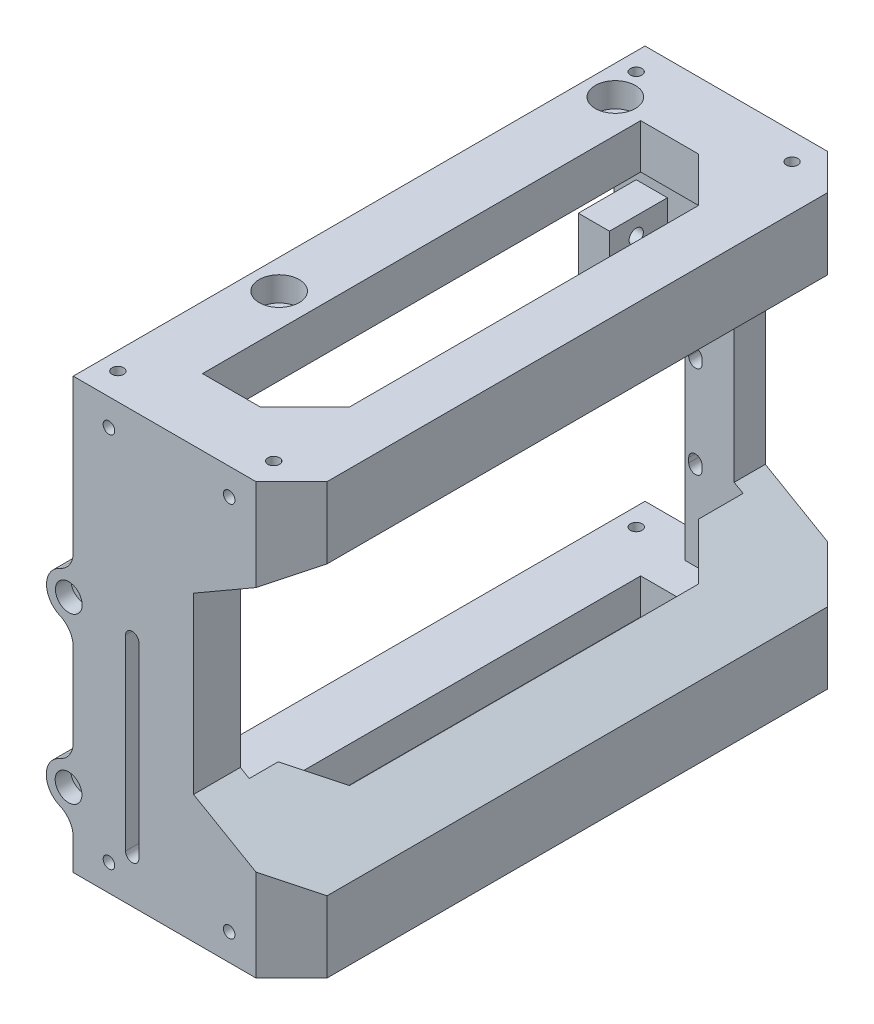
from build123d import *

# Parameters (mm, degrees)
SKETCH1_W            = 33.023864746
SKETCH1_H            = 96.550841869
BOSS_EXTRUDE1_DEPTH  = 10.5
SKETCH2_W            = 128.414742868
SKETCH2_H            = 96.550841869
BOSS_EXTRUDE2_DEPTH  = 10
SKETCH3_W            = 29.023864746
SKETCH3_H            = 117.914742868
BOSS_EXTRUDE3_DEPTH  = 10
SKETCH4_W            = 16
SKETCH4_H            = 7
BOSS_EXTRUDE4_DEPTH  = 96.550842
CUT_EXTRUDE1_DEPTH   = 10
SKETCH6_W            = 43.023864746
SKETCH6_H            = 8
BOSS_EXTRUDE5_DEPTH  = 115
SKETCH7_W            = 106
SKETCH7_H            = 44
CUT_EXTRUDE2_DEPTH   = 115
SKETCH8_W            = 10
SKETCH8_H            = 96.550841869
BOSS_EXTRUDE6_DEPTH  = 128.414743
CUT_EXTRUDE3_DEPTH   = 210
CHAMFER1_SIZE        = 8
CUT_EXTRUDE4_DEPTH   = 210
SKETCH11_W           = 149.172652418
SKETCH11_H           = 103.352018373
CUT_EXTRUDE5_DEPTH   = 16
BOSS_EXTRUDE7_START  = -10.5
SKETCH12_R           = 5
SKETCH12_R_2         = 1.49999954
BOSS_EXTRUDE7_DEPTH  = 10.5
FILLET1_R            = 5
BOSS_EXTRUDE8_REACH  = 652.428
CUT_EXTRUDE6_DEPTH   = 3.5
SKETCH15_R           = 4.5
CUT_EXTRUDE7_DEPTH   = 5.5
SKETCH16_R           = 3
SKETCH16_R_2         = 2.65
BOSS_EXTRUDE9_DEPTH  = 4.5
SKETCH17_R           = 3
CUT_EXTRUDE8_DEPTH   = 3.5
BOSS_EXTRUDE10_START = -7
SKETCH18_W           = 13.023864746
SKETCH18_H           = 35
BOSS_EXTRUDE10_DEPTH = 7
SKETCH19_W           = 12
SKETCH19_H           = 2
CUT_EXTRUDE9_DEPTH   = 3
SKETCH20_W           = 13
SKETCH20_H           = 25
BOSS_EXTRUDE11_DEPTH = 7
SKETCH22_R           = 1.6
CUT_EXTRUDE10_DEPTH  = 10
CUT_EXTRUDE11_DEPTH  = 3.5
SKETCH26_R           = 1.3
CUT_EXTRUDE13_DEPTH  = 12
SKETCH27_R           = 1.3
CUT_EXTRUDE14_DEPTH  = 12
CUT_EXTRUDE15_START  = -12
SKETCH28_R           = 1.3
CUT_EXTRUDE15_DEPTH  = 12
CUT_EXTRUDE16_START  = -12
SKETCH29_R           = 1.3
CUT_EXTRUDE16_DEPTH  = 12
CUT_EXTRUDE17_DEPTH  = 5
CHAMFER2_SIZE        = 3


with BuildPart() as part:
    # Sketch1 → Boss-Extrude1 (new body)
    with BuildSketch(Plane.XY):
        with Locations((-614.925933838, 559.805450232)):
            Rectangle(SKETCH1_W, SKETCH1_H)
        with BuildLine():
            Line((-612.69214266, 563.58759012), (-612.69214266, 521.58759284))
            ThreePointArc((-612.69214266, 521.58759284), (-614.1921422, 520.0875933), (-615.69214174, 521.58759284))
            Line((-615.69214174, 521.58759284), (-615.69214174, 563.58759012))
            ThreePointArc((-615.69214174, 563.58759012), (-614.1921422, 565.08758966), (-612.69214266, 563.58759012))
        make_face(mode=Mode.SUBTRACT)
        with BuildLine():
            ThreePointArc((-627.420522995, 528.643794724), (-629.559518923, 528.646587243), (-629.526513109, 526.507844154))
            ThreePointArc((-629.526513109, 526.507844154), (-627.423249907, 526.540283149), (-627.420522995, 528.643794724))
        make_face(mode=Mode.SUBTRACT)
        with BuildLine():
            ThreePointArc((-627.687834599, 565.892464542), (-629.745415286, 565.328506193), (-629.15786063, 563.277538902))
            ThreePointArc((-629.15786063, 563.277538902), (-627.130282586, 563.85836376), (-627.687834599, 565.892464542))
        make_face(mode=Mode.SUBTRACT)
    extrude(amount=BOSS_EXTRUDE1_DEPTH)

    # Sketch2 → Boss-Extrude2 (add)
    with BuildSketch(Plane(origin=(-598.414001465, 0, 0), x_dir=(0, 0, -1), z_dir=(1, 0, 0))):
        with Locations((53.707371434, 559.805450232)):
            Rectangle(SKETCH2_W, SKETCH2_H)
    extrude(amount=BOSS_EXTRUDE2_DEPTH)

    # Sketch3 → Boss-Extrude3 (add)
    with BuildSketch(Plane(origin=(0, 608.080871166, 0), x_dir=(1, 0, 0), z_dir=(0, 1, 0))):
        with Locations((-612.925933838, 58.957371434)):
            Rectangle(SKETCH3_W, SKETCH3_H)
        with BuildLine():
            add(Edge.make_bspline(
                [(-620.855368678, 107.664688934), (-626.855368677, 107.664613282), (-626.855293024, 101.664613282), (-620.855293025, 101.664688935), (-614.855293025, 101.664764588), (-614.855368678, 107.664764587), (-620.855368678, 107.664688934)],
                knots=[0, 0, 0, 0, 0.5, 0.5, 0.5, 1, 1, 1, 1], degree=3, weights=[1, 0.333333333, 0.333333333, 1, 0.333333333, 0.333333333, 1]))
        make_face(mode=Mode.SUBTRACT)
        with BuildLine():
            add(Edge.make_bspline(
                [(-620.854416712, 32.16468894), (-626.854416712, 32.164613288), (-626.854341059, 26.164613288), (-620.85434106, 26.164688941), (-614.85434106, 26.164764594), (-614.854416713, 32.164764593), (-620.854416712, 32.16468894)],
                knots=[0, 0, 0, 0, 0.5, 0.5, 0.5, 1, 1, 1, 1], degree=3, weights=[1, 0.333333333, 0.333333333, 1, 0.333333333, 0.333333333, 1]))
        make_face(mode=Mode.SUBTRACT)
    extrude(amount=-BOSS_EXTRUDE3_DEPTH)

    # Sketch4 → Boss-Extrude4 (add)
    with BuildSketch(Plane.XZ.offset(-511.530029297)):
        with Locations((-606.414001465, -114.414742868)):
            Rectangle(SKETCH4_W, SKETCH4_H)
    extrude(amount=-BOSS_EXTRUDE4_DEPTH)

    # Sketch5 → Cut-Extrude1 (cut)
    with BuildSketch(Plane(origin=(0, 0, -117.914742868), x_dir=(-1, 0, 0), z_dir=(0, 0, -1))):
        with BuildLine():
            Line((610.62434136, 538.90519346), (610.62434136, 539.90519146))
            ThreePointArc((610.62434136, 539.90519146), (609.12434182, 541.405191), (607.62434228, 539.90519146))
            Line((607.62434228, 539.90519146), (607.62434228, 538.90519346))
            ThreePointArc((607.62434228, 538.90519346), (609.12434182, 537.40519392), (610.62434136, 538.90519346))
        make_face()
        with BuildLine():
            Line((610.62434136, 559.6099933), (610.62434136, 560.6099913))
            ThreePointArc((610.62434136, 560.6099913), (609.12434182, 562.10999084), (607.62434228, 560.6099913))
            Line((607.62434228, 560.6099913), (607.62434228, 559.6099933))
            ThreePointArc((607.62434228, 559.6099933), (609.12434182, 558.10999376), (610.62434136, 559.6099933))
        make_face()
    extrude(amount=-CUT_EXTRUDE1_DEPTH, mode=Mode.SUBTRACT)

    # Sketch6 → Boss-Extrude5 (add)
    with BuildSketch(Plane(origin=(0, 0, -117.914742868), x_dir=(-1, 0, 0), z_dir=(0, 0, -1))):
        with Locations((609.925933838, 515.530029297)):
            Rectangle(SKETCH6_W, SKETCH6_H)
    extrude(amount=-BOSS_EXTRUDE5_DEPTH)

    # Sketch7 → Cut-Extrude2 (cut)
    with BuildSketch(Plane(origin=(-588.414001465, 0, 0), x_dir=(0, 0, -1), z_dir=(1, 0, 0))):
        with Locations((57.914742868, 541.530029297)):
            Rectangle(SKETCH7_W, SKETCH7_H)
    extrude(amount=-CUT_EXTRUDE2_DEPTH, mode=Mode.SUBTRACT)

    # Sketch8 → Boss-Extrude6 (add)
    with BuildSketch(Plane(origin=(0, 0, -117.914742868), x_dir=(-1, 0, 0), z_dir=(0, 0, -1))):
        with Locations((583.414001465, 559.805450232)):
            Rectangle(SKETCH8_W, SKETCH8_H)
    extrude(amount=-BOSS_EXTRUDE6_DEPTH)

    # Sketch9 → Cut-Extrude3 (cut)
    with BuildSketch(Plane(origin=(0, 0, -117.914742868), x_dir=(-1, 0, 0), z_dir=(0, 0, -1))):
        Polygon((600.414001465, 579.379165244), (578.414001465, 592.080871166), (578.414001465, 527.530029297), (600.414001465, 540.231735219), align=None)
    extrude(amount=-CUT_EXTRUDE3_DEPTH, mode=Mode.SUBTRACT)

    # Chamfer1
    chamfer1_edges = [part.edges().sort_by_distance(p)[0] for p in [
        (-578.414001465, 600.080871166, 10.500000132),
        (-578.414001465, 600.080871166, -117.914742868),
        (-578.414001465, 519.530029297, -117.914742868),
        (-578.414001465, 519.530029297, 10.500000132),
    ]]
    chamfer(chamfer1_edges, length=CHAMFER1_SIZE)

    # Sketch10 → Cut-Extrude4 (cut)
    with BuildSketch(Plane(origin=(0, 608.080871166, 0), x_dir=(1, 0, 0), z_dir=(0, 1, 0))):
        Polygon((-613.414001465, 102.914742868), (-600.414001465, 102.914742868), (-590.414001465, 92.914742868), (-590.414001465, 14.5), (-600.414001465, 4.5), (-613.414001465, 4.5), align=None)
    extrude(amount=-CUT_EXTRUDE4_DEPTH, mode=Mode.SUBTRACT)

    # Sketch11 → Cut-Extrude5 (cut)
    with BuildSketch(Plane.ZY.offset(627.437866211)):
        with Locations((-54.311497441, 560.688403626)):
            Rectangle(SKETCH11_W, SKETCH11_H)
    extrude(amount=CUT_EXTRUDE5_DEPTH, mode=Mode.SUBTRACT)

    # Sketch12 → Boss-Extrude7 (add)
    # profile 1 of 2: a face of its own
    with BuildSketch(Plane.XY.offset(10.5).offset(BOSS_EXTRUDE7_START)):
        with Locations((-628.43783126, 564.59342504)):
            Circle(SKETCH12_R)
        with Locations(Location((-628.43783126, 564.59342504, 0), (0, 0, 180))):
            Circle(SKETCH12_R_2, mode=Mode.SUBTRACT)
    # profile 2 of 2: a face of its own
    with BuildSketch(Plane.XY.offset(10.5).offset(BOSS_EXTRUDE7_START)):
        with Locations((-628.49137446, 527.59342538)):
            Circle(SKETCH12_R)
        with Locations((-628.49137446, 527.59342538)):
            Circle(SKETCH12_R_2, mode=Mode.SUBTRACT)
    extrude(amount=BOSS_EXTRUDE7_DEPTH)

    # Fillet1
    fillet1_edges = [part.edges().sort_by_distance(p)[0] for p in [
        (-627.437866211, 522.705673303, 5.25),
        (-627.437866211, 532.481177457, 5.25),
        (-627.437866211, 559.69443842, 5.25),
        (-627.437866211, 569.49241166, 5.25),
    ]]
    fillet(fillet1_edges, radius=FILLET1_R)

    # Boss-Extrude8: up to this plane
    boss_extrude8_end = Plane(origin=(83.823702949, 145.186912386, 92.085257132), z_dir=(-0.5000000000000038, -0.8660254037844366, 0))
    # Sketch13 → Boss-Extrude8 (add, up to the surface)
    with BuildSketch(Plane(origin=(0, 519.530029297, 0), x_dir=(1, 0, 0), z_dir=(0, 1, 0)), mode=Mode.PRIVATE) as boss_extrude8_sk1:
        Polygon((-598.414001465, 4.914742868), (-598.414001465, 6.5), (-590.414001465, 14.5), (-590.414001465, 92.914742868), (-598.414001465, 100.914742868), (-598.414001465, 110.914742868), (-588.414001465, 110.914742868), (-588.414001465, 4.914742868), align=None)
    boss_extrude8_tool1 = split(extrude(boss_extrude8_sk1.sketch, amount=BOSS_EXTRUDE8_REACH, mode=Mode.PRIVATE), bisect_by=boss_extrude8_end, keep=Keep.BOTH, mode=Mode.PRIVATE)
    add(boss_extrude8_tool1.solids().sort_by_distance((-597.349295, 519.530029, -5.707371))[0])

    # Sketch14 → Cut-Extrude6 (cut)
    with BuildSketch(Plane(origin=(0, 0, -117.914742868), x_dir=(-1, 0, 0), z_dir=(0, 0, -1))):
        with BuildLine():
            Line((614.92434182, 560.6099913), (614.92434182, 559.6099933))
            ThreePointArc((614.92434182, 559.6099933), (609.12434182, 553.8099933), (603.32434182, 559.6099933))
            Line((603.32434182, 559.6099933), (603.32434182, 560.6099913))
            ThreePointArc((603.32434182, 560.6099913), (609.12434182, 566.4099913), (614.92434182, 560.6099913))
        make_face()
        with BuildLine():
            Line((614.92434182, 539.90519146), (614.92434182, 538.90519346))
            ThreePointArc((614.92434182, 538.90519346), (609.12434182, 533.10519346), (603.32434182, 538.90519346))
            Line((603.32434182, 538.90519346), (603.32434182, 539.90519146))
            ThreePointArc((603.32434182, 539.90519146), (609.12434182, 545.70519146), (614.92434182, 539.90519146))
        make_face()
    extrude(amount=-CUT_EXTRUDE6_DEPTH, mode=Mode.SUBTRACT)

    # Sketch15 → Cut-Extrude7 (cut)
    with BuildSketch(Plane(origin=(0, 608.080871166, 0), x_dir=(1, 0, 0), z_dir=(0, 1, 0))):
        with Locations(Location((-620.854378886, 29.164688941, 0), (0, 0, 270))):
            Circle(SKETCH15_R)
        with Locations(Location((-620.855330851, 104.664688935, 0), (0, 0, 270))):
            Circle(SKETCH15_R)
    extrude(amount=-CUT_EXTRUDE7_DEPTH, mode=Mode.SUBTRACT)

    # Sketch16 → Boss-Extrude9 (add)
    # profile 1 of 2: a face of its own
    with BuildSketch(Plane(origin=(0, 602.580871166, 0), x_dir=(1, 0, 0), z_dir=(0, 1, 0))):
        with Locations((-620.855330851, 104.664688935)):
            Circle(SKETCH16_R)
        with Locations(Location((-620.855330851, 104.664688935, 0), (0, 0, 270))):
            Circle(SKETCH16_R_2, mode=Mode.SUBTRACT)
    # profile 2 of 2: a face of its own
    with BuildSketch(Plane(origin=(0, 602.580871166, 0), x_dir=(1, 0, 0), z_dir=(0, 1, 0))):
        with Locations((-620.854378886, 29.164688941)):
            Circle(SKETCH16_R)
        with Locations(Location((-620.854378886, 29.164688941, 0), (0, 0, 270))):
            Circle(SKETCH16_R_2, mode=Mode.SUBTRACT)
    extrude(amount=-BOSS_EXTRUDE9_DEPTH)

    # Sketch17 → Cut-Extrude8 (cut)
    with BuildSketch(Plane.XY.offset(10.5)):
        with Locations((-628.43783126, 564.59342504)):
            Circle(SKETCH17_R)
        with Locations((-628.49137446, 527.59342538)):
            Circle(SKETCH17_R)
    extrude(amount=-CUT_EXTRUDE8_DEPTH, mode=Mode.SUBTRACT)

    # Sketch18 → Boss-Extrude10 (add)
    with BuildSketch(Plane(origin=(0, 0, -117.914742868), x_dir=(-1, 0, 0), z_dir=(0, 0, -1)).offset(BOSS_EXTRUDE10_START)):
        with Locations((620.925933838, 580.580871166)):
            Rectangle(SKETCH18_W, SKETCH18_H)
    extrude(amount=BOSS_EXTRUDE10_DEPTH)

    # Sketch19 → Cut-Extrude9 (cut)
    with BuildSketch(Plane.XZ.offset(-598.080871166)):
        with Locations((-621.437866211, -111.914742868)):
            Rectangle(SKETCH19_W, SKETCH19_H)
    extrude(amount=CUT_EXTRUDE9_DEPTH, mode=Mode.SUBTRACT)

    # Sketch20 → Boss-Extrude11 (add)
    with BuildSketch(Plane(origin=(-615.414001465, 0, 0), x_dir=(0, 0, -1), z_dir=(1, 0, 0))):
        with Locations((104.414742868, 575.580871166)):
            Rectangle(SKETCH20_W, SKETCH20_H)
        Polygon((3, 563.080871166), (13, 563.080871166), (13, 598.080871166), (0, 598.080871166), (0, 581.080871166), (3, 581.080871166), align=None)
    extrude(amount=-BOSS_EXTRUDE11_DEPTH)

    # Sketch22 → Cut-Extrude10 (cut)
    with BuildSketch(Plane(origin=(-615.414001465, 0, 0), x_dir=(0, 0, -1), z_dir=(1, 0, 0))):
        with Locations((7, 584.080871166)):
            Circle(SKETCH22_R)
        with Locations((7, 568.080871166)):
            Circle(SKETCH22_R)
        with Locations((103.914742868, 584.080871166)):
            Circle(SKETCH22_R)
        with Locations((103.914742868, 568.080871166)):
            Circle(SKETCH22_R)
    extrude(amount=-CUT_EXTRUDE10_DEPTH, mode=Mode.SUBTRACT)

    # Sketch23 → Cut-Extrude11 (cut)
    with BuildSketch(Plane.ZY.offset(622.414001465)):
        Polygon((-4.1, 569.755186947), (-7, 571.429502727), (-9.9, 569.755186947), (-9.9, 566.406555385), (-7, 564.732239605), (-4.1, 566.406555385), align=None)
        Polygon((-4.1, 585.755186947), (-7, 587.429502727), (-9.9, 585.755186947), (-9.9, 582.406555385), (-7, 580.732239605), (-4.1, 582.406555385), align=None)
        Polygon((-103.914742868, 571.429502727), (-106.814742868, 569.755186947), (-106.814742868, 566.406555385), (-103.914742868, 564.732239605), (-101.014742868, 566.406555385), (-101.014742868, 569.755186947), align=None)
        Polygon((-106.814742868, 585.755186947), (-106.814742868, 582.406555385), (-103.914742868, 580.732239605), (-101.014742868, 582.406555385), (-101.014742868, 585.755186947), (-103.914742868, 587.429502727), align=None)
    extrude(amount=-CUT_EXTRUDE11_DEPTH, mode=Mode.SUBTRACT)

    # Sketch26 → Cut-Extrude13 (cut)
    with BuildSketch(Plane.XZ.offset(-511.530029297)):
        with Locations(Location((-623.414001465, 4.5, 0), (0, 0, 270))):
            Circle(SKETCH26_R)
        with Locations(Location((-588.414001465, 4.5, 0), (0, 0, 270))):
            Circle(SKETCH26_R)
        with Locations(Location((-623.414001465, -111.914742868, 0), (0, 0, 270))):
            Circle(SKETCH26_R)
        with Locations(Location((-588.414001465, -111.914742868, 0), (0, 0, 270))):
            Circle(SKETCH26_R)
    extrude(amount=-CUT_EXTRUDE13_DEPTH, mode=Mode.SUBTRACT)

    # Sketch27 → Cut-Extrude14 (cut)
    with BuildSketch(Plane.XY.offset(10.5)):
        with Locations((-619.414001465, 602.080871166)):
            Circle(SKETCH27_R)
        with Locations((-592.414001465, 602.080871166)):
            Circle(SKETCH27_R)
        with Locations((-619.414001465, 517.530029297)):
            Circle(SKETCH27_R)
        with Locations((-592.414001465, 517.530029297)):
            Circle(SKETCH27_R)
    extrude(amount=-CUT_EXTRUDE14_DEPTH, mode=Mode.SUBTRACT)

    # Sketch28 → Cut-Extrude15 (cut)
    with BuildSketch(Plane(origin=(0, 608.080871166, 0), x_dir=(1, 0, 0), z_dir=(0, 1, 0)).offset(CUT_EXTRUDE15_START)):
        with Locations(Location((-623.414001465, 111.914742868, 0), (0, 0, 90))):
            Circle(SKETCH28_R)
        with Locations(Location((-588.414001465, 111.914742868, 0), (0, 0, 90))):
            Circle(SKETCH28_R)
        with Locations(Location((-623.414001465, -4.5, 0), (0, 0, 90))):
            Circle(SKETCH28_R)
        with Locations(Location((-588.414001465, -4.5, 0), (0, 0, 90))):
            Circle(SKETCH28_R)
    extrude(amount=CUT_EXTRUDE15_DEPTH, mode=Mode.SUBTRACT)

    # Sketch29 → Cut-Extrude16 (cut)
    with BuildSketch(Plane(origin=(0, 0, -117.914742868), x_dir=(-1, 0, 0), z_dir=(0, 0, -1)).offset(CUT_EXTRUDE16_START)):
        with Locations(Location((592.414001465, 602.080871166, 0), (0, 0, 180))):
            Circle(SKETCH29_R)
        with Locations(Location((619.414001465, 602.080871166, 0), (0, 0, 180))):
            Circle(SKETCH29_R)
        with Locations(Location((592.414001465, 517.530029297, 0), (0, 0, 180))):
            Circle(SKETCH29_R)
        with Locations(Location((619.414001465, 517.530029297, 0), (0, 0, 180))):
            Circle(SKETCH29_R)
    extrude(amount=CUT_EXTRUDE16_DEPTH, mode=Mode.SUBTRACT)

    # Sketch30 → Cut-Extrude17 (cut)
    with BuildSketch(Plane.XZ.offset(-598.080871166)):
        with BuildLine():
            Line((-625.854378886, -29.164688941), (-627.437866211, -29.164688941))
            Line((-627.437866211, -29.164688941), (-627.437866211, -104.664688935))
            Line((-627.437866211, -104.664688935), (-625.855330851, -104.664688935))
            ThreePointArc((-625.855330851, -104.664688935), (-624.390864757, -101.129155029), (-620.855330851, -99.664688935))
            Line((-620.855330851, -99.664688935), (-620.855330851, -34.16468885))
            ThreePointArc((-620.855330851, -34.16468885), (-624.390249346, -32.69988626), (-625.854378886, -29.164688941))
        make_face()
    extrude(amount=-CUT_EXTRUDE17_DEPTH, mode=Mode.SUBTRACT)

    # Chamfer2
    chamfer2_edges = [part.edges().sort_by_distance(p)[0] for p in [
        (-614.414001465, 541.305450231, -110.914742868),
    ]]
    chamfer(chamfer2_edges, length=CHAMFER2_SIZE)


solid = part.part
